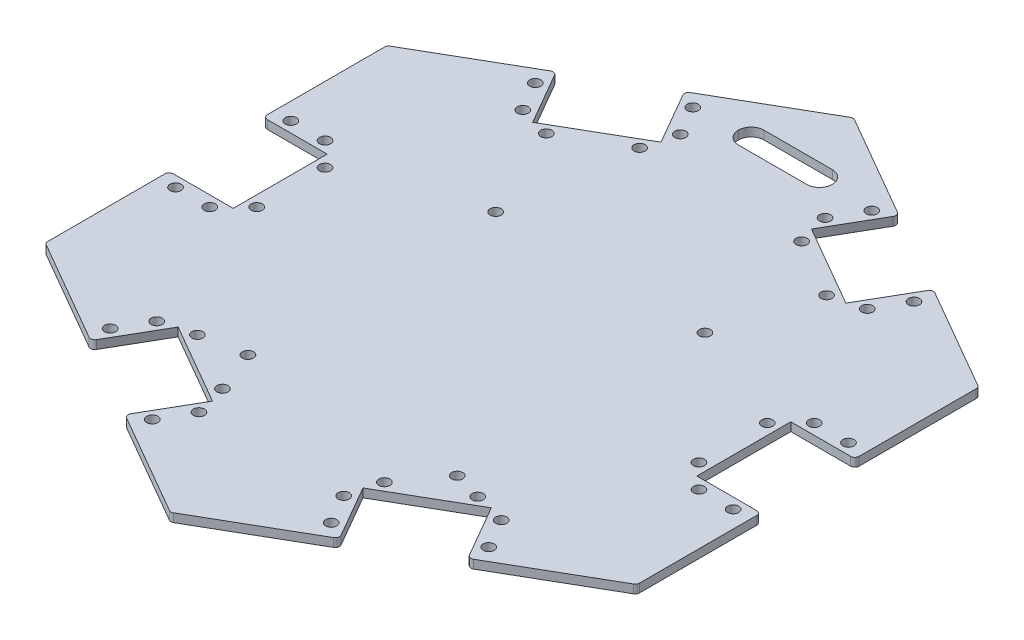
from build123d import *

# Parameters (mm, degrees)
SKETCH1_R           = 1.3
BOSS_EXTRUDE1_DEPTH = 2
SKETCH2_W           = 15
SKETCH2_H           = 22
CUT_EXTRUDE1_DEPTH  = 2
FILLET1_R           = 1
SKETCH3_R           = 1.3
CUT_EXTRUDE2_DEPTH  = 2
SKETCH4_W           = 22
SKETCH4_H           = 6
CUT_EXTRUDE3_DEPTH  = 2
FILLET2_R           = 3


with BuildPart() as part:
    # Sketch1 → Boss-Extrude1 (new body)
    with BuildSketch(Plane(origin=(0, 0, 0), x_dir=(1, 0, 0), z_dir=(0, 1, 0))):
        Polygon((0, -80), (69.282032303, -40), (69.282032303, 40), (0, 80), (-69.282032303, 40), (-69.282032303, -40), align=None)
        with Locations(Location((65.282032303, 13.5, 0), (0, 0, 270))):
            Circle(SKETCH1_R, mode=Mode.SUBTRACT)
        with Locations(Location((57.282032303, 13.5, 0), (0, 0, 270))):
            Circle(SKETCH1_R, mode=Mode.SUBTRACT)
        with Locations(Location((51.782032303, 8, 0), (0, 0, 270))):
            Circle(SKETCH1_R, mode=Mode.SUBTRACT)
        with Locations(Location((51.782032303, -8, 0), (0, 0, 270))):
            Circle(SKETCH1_R, mode=Mode.SUBTRACT)
        with Locations(Location((57.282032303, -13.5, 0), (0, 0, 270))):
            Circle(SKETCH1_R, mode=Mode.SUBTRACT)
        with Locations(Location((65.282032303, -13.5, 0), (0, 0, 270))):
            Circle(SKETCH1_R, mode=Mode.SUBTRACT)
        with Locations(Location((32.819219382, -40.844555434, 0), (0, 0, 270))):
            Circle(SKETCH1_R, mode=Mode.SUBTRACT)
        with Locations(Location((20.9496732, -63.285898385, 0), (0, 0, 270))):
            Circle(SKETCH1_R, mode=Mode.SUBTRACT)
        with Locations(Location((16.9496732, -56.357695155, 0), (0, 0, 270))):
            Circle(SKETCH1_R, mode=Mode.SUBTRACT)
        with Locations(Location((18.962812921, -48.844555434, 0), (0, 0, 270))):
            Circle(SKETCH1_R, mode=Mode.SUBTRACT)
        with Locations(Location((44.332359102, -49.785898385, 0), (0, 0, 270))):
            Circle(SKETCH1_R, mode=Mode.SUBTRACT)
        with Locations(Location((40.332359102, -42.857695155, 0), (0, 0, 270))):
            Circle(SKETCH1_R, mode=Mode.SUBTRACT)
        with Locations(Location((-44.332359102, -49.785898385, 0), (0, 0, 270))):
            Circle(SKETCH1_R, mode=Mode.SUBTRACT)
        with Locations(Location((-40.332359102, -42.857695155, 0), (0, 0, 270))):
            Circle(SKETCH1_R, mode=Mode.SUBTRACT)
        with Locations(Location((-32.819219382, -40.844555434, 0), (0, 0, 270))):
            Circle(SKETCH1_R, mode=Mode.SUBTRACT)
        with Locations(Location((-18.962812921, -48.844555434, 0), (0, 0, 270))):
            Circle(SKETCH1_R, mode=Mode.SUBTRACT)
        with Locations(Location((-16.9496732, -56.357695155, 0), (0, 0, 270))):
            Circle(SKETCH1_R, mode=Mode.SUBTRACT)
        with Locations(Location((-20.9496732, -63.285898385, 0), (0, 0, 270))):
            Circle(SKETCH1_R, mode=Mode.SUBTRACT)
        with Locations(Location((18.962812921, 48.844555434, 0), (0, 0, 270))):
            Circle(SKETCH1_R, mode=Mode.SUBTRACT)
        with Locations(Location((44.332359102, 49.785898385, 0), (0, 0, 270))):
            Circle(SKETCH1_R, mode=Mode.SUBTRACT)
        with Locations(Location((40.332359102, 42.857695155, 0), (0, 0, 270))):
            Circle(SKETCH1_R, mode=Mode.SUBTRACT)
        with Locations(Location((32.819219382, 40.844555434, 0), (0, 0, 270))):
            Circle(SKETCH1_R, mode=Mode.SUBTRACT)
        with Locations(Location((20.9496732, 63.285898385, 0), (0, 0, 270))):
            Circle(SKETCH1_R, mode=Mode.SUBTRACT)
        with Locations(Location((16.9496732, 56.357695155, 0), (0, 0, 270))):
            Circle(SKETCH1_R, mode=Mode.SUBTRACT)
        with Locations(Location((-65.282032303, 13.5, 0), (0, 0, 270))):
            Circle(SKETCH1_R, mode=Mode.SUBTRACT)
        with Locations(Location((-20.9496732, 63.285898385, 0), (0, 0, 270))):
            Circle(SKETCH1_R, mode=Mode.SUBTRACT)
        with Locations(Location((-16.9496732, 56.357695155, 0), (0, 0, 270))):
            Circle(SKETCH1_R, mode=Mode.SUBTRACT)
        with Locations(Location((-18.962812921, 48.844555434, 0), (0, 0, 270))):
            Circle(SKETCH1_R, mode=Mode.SUBTRACT)
        with Locations(Location((-32.819219382, 40.844555434, 0), (0, 0, 270))):
            Circle(SKETCH1_R, mode=Mode.SUBTRACT)
        with Locations(Location((-44.332359102, 49.785898385, 0), (0, 0, 270))):
            Circle(SKETCH1_R, mode=Mode.SUBTRACT)
        with Locations(Location((-40.332359102, 42.857695155, 0), (0, 0, 270))):
            Circle(SKETCH1_R, mode=Mode.SUBTRACT)
        with Locations(Location((-57.282032303, 13.5, 0), (0, 0, 270))):
            Circle(SKETCH1_R, mode=Mode.SUBTRACT)
        with Locations(Location((-51.782032303, 8, 0), (0, 0, 270))):
            Circle(SKETCH1_R, mode=Mode.SUBTRACT)
        with Locations(Location((-51.782032303, -8, 0), (0, 0, 270))):
            Circle(SKETCH1_R, mode=Mode.SUBTRACT)
        with Locations(Location((-57.282032303, -13.5, 0), (0, 0, 270))):
            Circle(SKETCH1_R, mode=Mode.SUBTRACT)
        with Locations(Location((-65.282032303, -13.5, 0), (0, 0, 270))):
            Circle(SKETCH1_R, mode=Mode.SUBTRACT)
    extrude(amount=BOSS_EXTRUDE1_DEPTH)

    # Sketch2 → Cut-Extrude1 (cut)
    with BuildSketch(Plane(origin=(0, 2, 0), x_dir=(1, 0, 0), z_dir=(0, 1, 0))):
        with Locations((61.782032303, 0)):
            Rectangle(SKETCH2_W, SKETCH2_H)
        Polygon((44.167295593, -54.5), (36.667295593, -41.509618943), (17.61473671, -52.509618943), (25.11473671, -65.5), align=None)
        Polygon((-25.11473671, -65.5), (-44.167295593, -54.5), (-36.667295593, -41.509618943), (-17.61473671, -52.509618943), align=None)
        Polygon((25.11473671, 65.5), (17.61473671, 52.509618943), (36.667295593, 41.509618943), (44.167295593, 54.5), align=None)
        Polygon((-44.167295593, 54.5), (-25.11473671, 65.5), (-17.61473671, 52.509618943), (-36.667295593, 41.509618943), align=None)
        with Locations((-61.782032303, 0)):
            Rectangle(SKETCH2_W, SKETCH2_H)
    extrude(amount=-CUT_EXTRUDE1_DEPTH, mode=Mode.SUBTRACT)

    # Fillet1
    fillet1_edges = [part.edges().sort_by_distance(p)[0] for p in [
        (69.282032303, 1, -11),
        (69.282032303, 1, 11),
        (44.167295593, 1, 54.5),
        (25.11473671, 1, 65.5),
        (-25.11473671, 1, 65.5),
        (-44.167295593, 1, 54.5),
        (25.11473671, 1, -65.5),
        (44.167295593, 1, -54.5),
        (-44.167295593, 1, -54.5),
        (-25.11473671, 1, -65.5),
        (-69.282032303, 1, 11),
        (-69.282032303, 1, -11),
        (-69.282032303, 1, -40),
        (0, 1, -80),
        (69.282032303, 1, -40),
        (69.282032303, 1, 40),
        (0, 1, 80),
        (-69.282032303, 1, 40),
    ]]
    fillet(fillet1_edges, radius=FILLET1_R)

    # Sketch3 → Cut-Extrude2 (cut)
    with BuildSketch(Plane(origin=(0, 2, 0), x_dir=(1, 0, 0), z_dir=(0, 1, 0))):
        with Locations(Location((-22.836753878, -38.995299462, 0), (0, 0, 270))):
            Circle(SKETCH3_R)
        with Locations(Location((-22.836753878, 19.004700538, 0), (0, 0, 270))):
            Circle(SKETCH3_R)
        with Locations(Location((26.163246122, 19.004700538, 0), (0, 0, 270))):
            Circle(SKETCH3_R)
        with Locations(Location((26.163246122, -38.995299462, 0), (0, 0, 270))):
            Circle(SKETCH3_R)
    extrude(amount=-CUT_EXTRUDE2_DEPTH, mode=Mode.SUBTRACT)

    # Sketch4 → Cut-Extrude3 (cut)
    with BuildSketch(Plane(origin=(0, 2, 0), x_dir=(1, 0, 0), z_dir=(0, 1, 0))):
        with Locations((0, 64)):
            Rectangle(SKETCH4_W, SKETCH4_H)
    extrude(amount=-CUT_EXTRUDE3_DEPTH, mode=Mode.SUBTRACT)

    # Fillet2
    fillet2_edges = [part.edges().sort_by_distance(p)[0] for p in [
        (11, 1, -67),
        (-11, 1, -67),
        (-11, 1, -61),
        (11, 1, -61),
    ]]
    fillet(fillet2_edges, radius=FILLET2_R - 0.0001)  # a hair under: the kernel refuses the full size


solid = part.part
